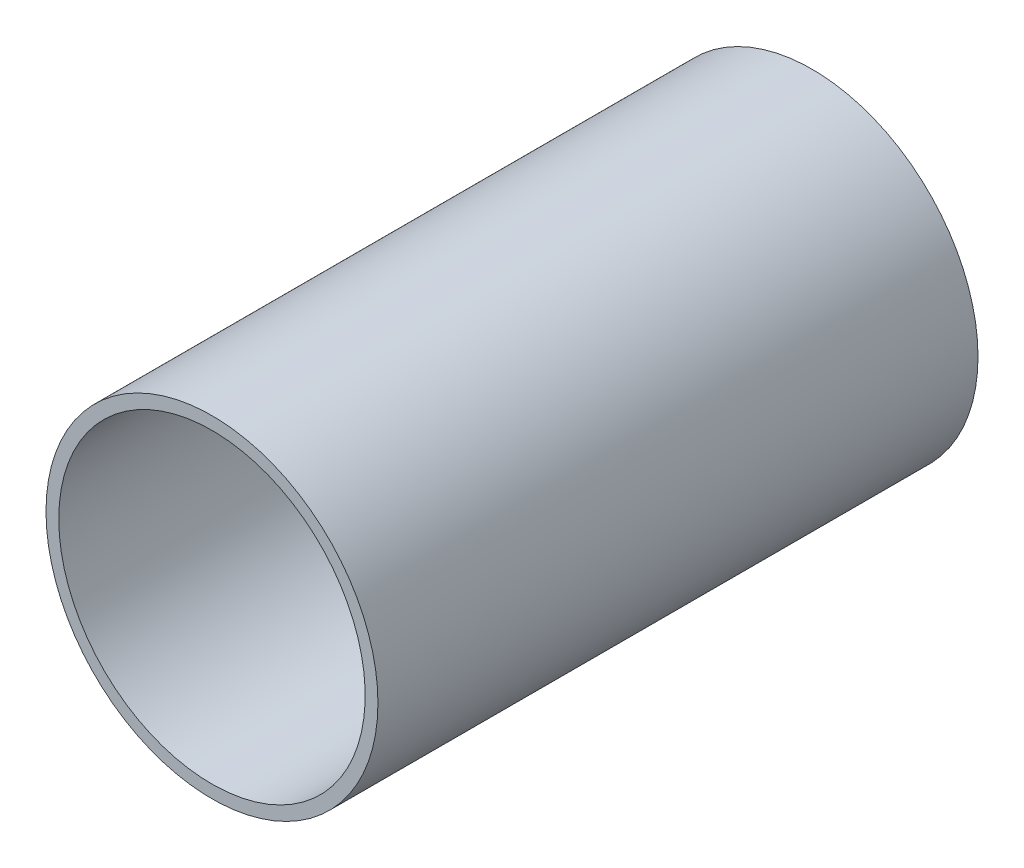
from build123d import *

# Parameters (mm, degrees)
ESQUISSE1_W = 6.35
ESQUISSE1_H = 298.45


with BuildPart() as part:
    # Esquisse1 → Révolution1 (revolve)
    with BuildSketch(Plane.XZ):
        with Locations((79.375, 0)):
            Rectangle(ESQUISSE1_W, ESQUISSE1_H)
    revolve(axis=Axis((0, 0, 149.225), (0, 0, -1)))


solid = part.part
